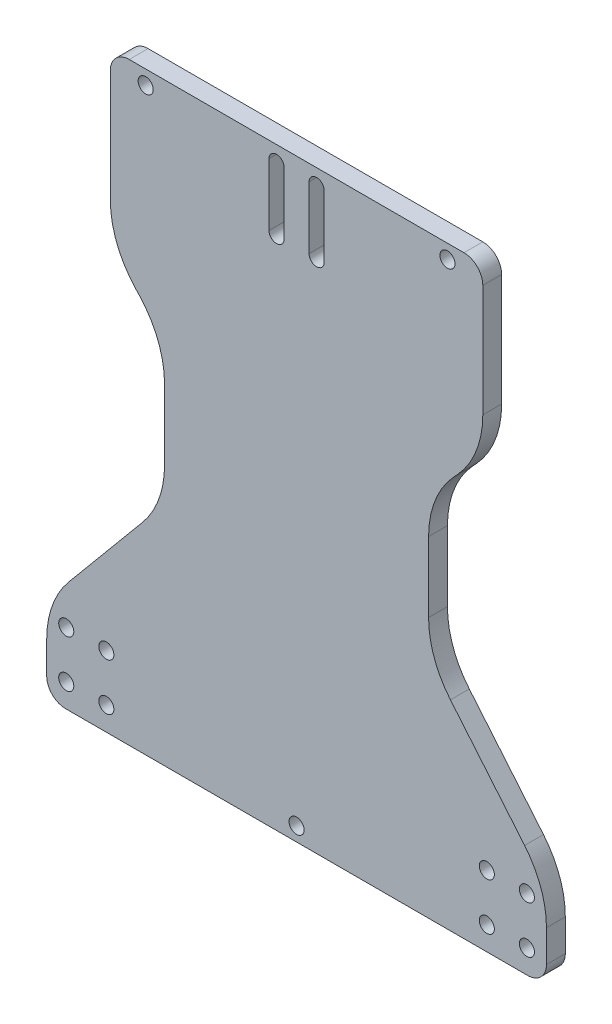
from build123d import *

# Parameters (mm, degrees)
SKETCH1_R           = 1.6
BOSS_EXTRUDE1_DEPTH = 4
FILLET1_R           = 4
FILLET2_R           = 20


with BuildPart() as part:
    # Sketch1 → Boss-Extrude1 (new body)
    with BuildSketch(Plane.XY):
        Polygon((0, 0), (106, 0), (106, 18), (81, 48), (81, 78), (92.5, 90.3404302), (92.5, 126), (13.5, 126), (13.5, 90.3404302), (25, 78), (25, 48), (0, 18), align=None)
        with Locations((4.15, 5)):
            Circle(SKETCH1_R, mode=Mode.SUBTRACT)
        with Locations((12.65, 5)):
            Circle(SKETCH1_R, mode=Mode.SUBTRACT)
        with Locations((12.65, 15)):
            Circle(SKETCH1_R, mode=Mode.SUBTRACT)
        with Locations((4.15, 15)):
            Circle(SKETCH1_R, mode=Mode.SUBTRACT)
        with Locations((101.85, 5)):
            Circle(SKETCH1_R, mode=Mode.SUBTRACT)
        with Locations((93.35, 5)):
            Circle(SKETCH1_R, mode=Mode.SUBTRACT)
        with Locations((93.35, 15)):
            Circle(SKETCH1_R, mode=Mode.SUBTRACT)
        with Locations((101.85, 15)):
            Circle(SKETCH1_R, mode=Mode.SUBTRACT)
        with Locations((53, 3)):
            Circle(SKETCH1_R, mode=Mode.SUBTRACT)
        with Locations((21, 123)):
            Circle(SKETCH1_R, mode=Mode.SUBTRACT)
        with Locations((85, 123)):
            Circle(SKETCH1_R, mode=Mode.SUBTRACT)
        with BuildLine():
            Line((50.35, 122.6), (50.35, 109.4))
            ThreePointArc((50.35, 109.4), (48.75, 107.8), (47.15, 109.4))
            Line((47.15, 109.4), (47.15, 122.6))
            ThreePointArc((47.15, 122.6), (48.75, 124.2), (50.35, 122.6))
        make_face(mode=Mode.SUBTRACT)
        with BuildLine():
            Line((55.65, 109.4), (55.65, 122.6))
            ThreePointArc((55.65, 122.6), (57.25, 124.2), (58.85, 122.6))
            Line((58.85, 122.6), (58.85, 109.4))
            ThreePointArc((58.85, 109.4), (57.25, 107.8), (55.65, 109.4))
        make_face(mode=Mode.SUBTRACT)
    extrude(amount=BOSS_EXTRUDE1_DEPTH)

    # Fillet1
    fillet1_edges = [part.edges().sort_by_distance(p)[0] for p in [
        (106, 0, 2),
        (0, 0, 2),
        (92.5, 126, 2),
        (13.5, 126, 2),
    ]]
    fillet(fillet1_edges, radius=FILLET1_R)

    # Fillet2
    fillet2_edges = [part.edges().sort_by_distance(p)[0] for p in [
        (81, 78, 2),
        (81, 48, 2),
        (106, 18, 2),
        (25, 78, 2),
        (25, 48, 2),
        (0, 18, 2),
        (92.5, 90.3404302, 2),
        (13.5, 90.3404302, 2),
    ]]
    fillet(fillet2_edges, radius=FILLET2_R)


solid = part.part
